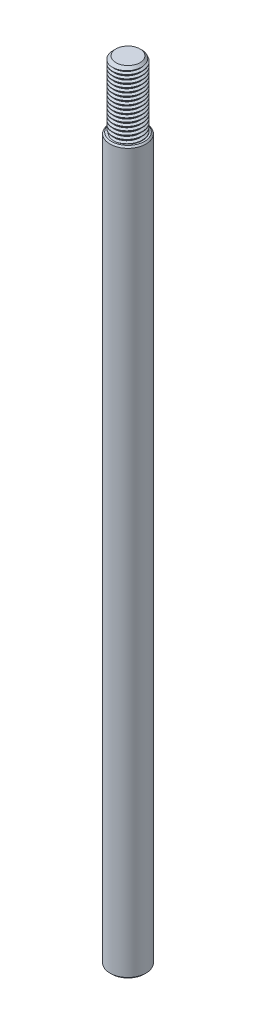
from build123d import *

# Parameters (mm, degrees)
SKETCH1_R           = 6
BOSS_EXTRUDE1_DEPTH = 262.5
SKETCH4_OUTSIDE_W   = 66.61
SKETCH4_OUTSIDE_H   = 66.61
SKETCH4_OUTSIDE_R   = 5
CUT_EXTRUDE1_DEPTH  = 22
CHAMFER2_SIZE       = 1
CHAMFER3_SIZE       = 0.5
THREAD1_PITCH       = 1.25
THREAD1_TO          = 22


with BuildPart() as part:
    # Sketch1 → Boss-Extrude1 (new body)
    with BuildSketch(Plane(origin=(0, 0, 0), x_dir=(1, 0, 0), z_dir=(0, 1, 0))):
        with Locations(Location((0, 0, 0), (0, 0, 270))):
            Circle(SKETCH1_R)
    extrude(amount=BOSS_EXTRUDE1_DEPTH)

    # Sketch4 outside → Cut-Extrude1 (cut)
    with BuildSketch(Plane(origin=(0, 262.5, 0), x_dir=(1, 0, 0), z_dir=(0, 1, 0))):
        Rectangle(SKETCH4_OUTSIDE_W, SKETCH4_OUTSIDE_H)
        with Locations(Location((0, 0, 0), (0, 0, 270))):
            Circle(SKETCH4_OUTSIDE_R, mode=Mode.SUBTRACT)
    extrude(amount=-CUT_EXTRUDE1_DEPTH, mode=Mode.SUBTRACT)

    # Chamfer2
    chamfer2_edges = [part.edges().sort_by_distance(p)[0] for p in [
        (0, 262.5, -5),
    ]]
    chamfer(chamfer2_edges, length=CHAMFER2_SIZE)

    # Chamfer3
    chamfer3_edges = [part.edges().sort_by_distance(p)[0] for p in [
        (0, 0, -6),
        (0, 240.5, -6),
    ]]
    chamfer(chamfer3_edges, length=CHAMFER3_SIZE)

    # Thread1: arcs per turn and ends read off the stored shape
    # Thread1: the profile of Thread Profile2 profile screwed along a right-hand helix through 17.6 turns, 8 arcs to a turn; built about Z, then put on its axis
    thread1_z = Axis((0, 0, 0), (0, 0, 1))
    thread1_corners = [(5.0003, 0, -0.000173205), (5.0003, 0, 1.093923202), (4.323417656, 0, 0.703124998), (4.323417656, 0, 0.390624998)]
    with BuildLine(mode=Mode.PRIVATE) as thread1_profile:
        Line(thread1_corners[0], thread1_corners[1])
        Line(thread1_corners[1], thread1_corners[2])
        Line(thread1_corners[2], thread1_corners[3])
        Line(thread1_corners[3], thread1_corners[0])
    thread1_cap = Face(thread1_profile.wire())
    thread1_turn_angles = [0, 22.5, 45, 67.5, 90, 112.5, 135, 157.5, 180, 202.5, 225, 247.5, 270, 292.5, 315, 337.5, 360]
    thread1_turn_weights = [1, 0.9238795325112867, 1, 0.9238795325112867, 1, 0.9238795325112867, 1, 0.9238795325112867, 1, 0.9238795325112867, 1, 0.9238795325112867, 1, 0.9238795325112867, 1, 0.9238795325112867, 1]
    thread1_turn_rails = [Edge.make_bspline([Vector(p[0], p[1], 0).rotate(thread1_z, thread1_turn_angles[k]) / thread1_turn_weights[k] + Vector(0, 0, p[2] + THREAD1_PITCH * thread1_turn_angles[k] / 360) for k in range(17)], [0, 0, 0, 1, 1, 2, 2, 3, 3, 4, 4, 5, 5, 6, 6, 7, 7, 8, 8, 8], 2, thread1_turn_weights) for p in thread1_corners]
    thread1_turn_sides = [Face.make_surface_from_curves(thread1_turn_rails[p[0]], thread1_turn_rails[p[1]]) for p in [(0, 1), (1, 2), (2, 3), (3, 0)]]
    thread1_last_angles = [6120, 6142.5, 6165, 6187.5, 6210, 6232.5, 6255, 6277.5, 6300, 6318, 6336]
    thread1_last_weights = [1, 0.9238795325112867, 1, 0.9238795325112867, 1, 0.9238795325112867, 1, 0.9238795325112867, 1, 0.9510565162951192, 1]
    thread1_last_rails = [Edge.make_bspline([Vector(p[0], p[1], 0).rotate(thread1_z, thread1_last_angles[k]) / thread1_last_weights[k] + Vector(0, 0, p[2] + THREAD1_PITCH * thread1_last_angles[k] / 360) for k in range(11)], [0, 0, 0, 1, 1, 2, 2, 3, 3, 4, 4, 5, 5, 5], 2, thread1_last_weights) for p in thread1_corners]
    thread1_last_sides = [Face.make_surface_from_curves(thread1_last_rails[p[0]], thread1_last_rails[p[1]]) for p in [(0, 1), (1, 2), (2, 3), (3, 0)]]
    thread1 = Plane(origin=(0, 262.5, 0), x_dir=(-1, 0, 0), z_dir=(0, -1, 0)) * split(Solid(Shell([*[p.moved(Location((0, 0, THREAD1_PITCH * i))) for i in range(17) for p in thread1_turn_sides], *thread1_last_sides, thread1_cap, thread1_cap.rotate(thread1_z, 6336).moved(Location((0, 0, THREAD1_PITCH * 6336 / 360)))])), bisect_by=Plane.XY.offset(THREAD1_TO), keep=Keep.BOTTOM, mode=Mode.PRIVATE)
    add(thread1, mode=Mode.SUBTRACT)


solid = part.part
